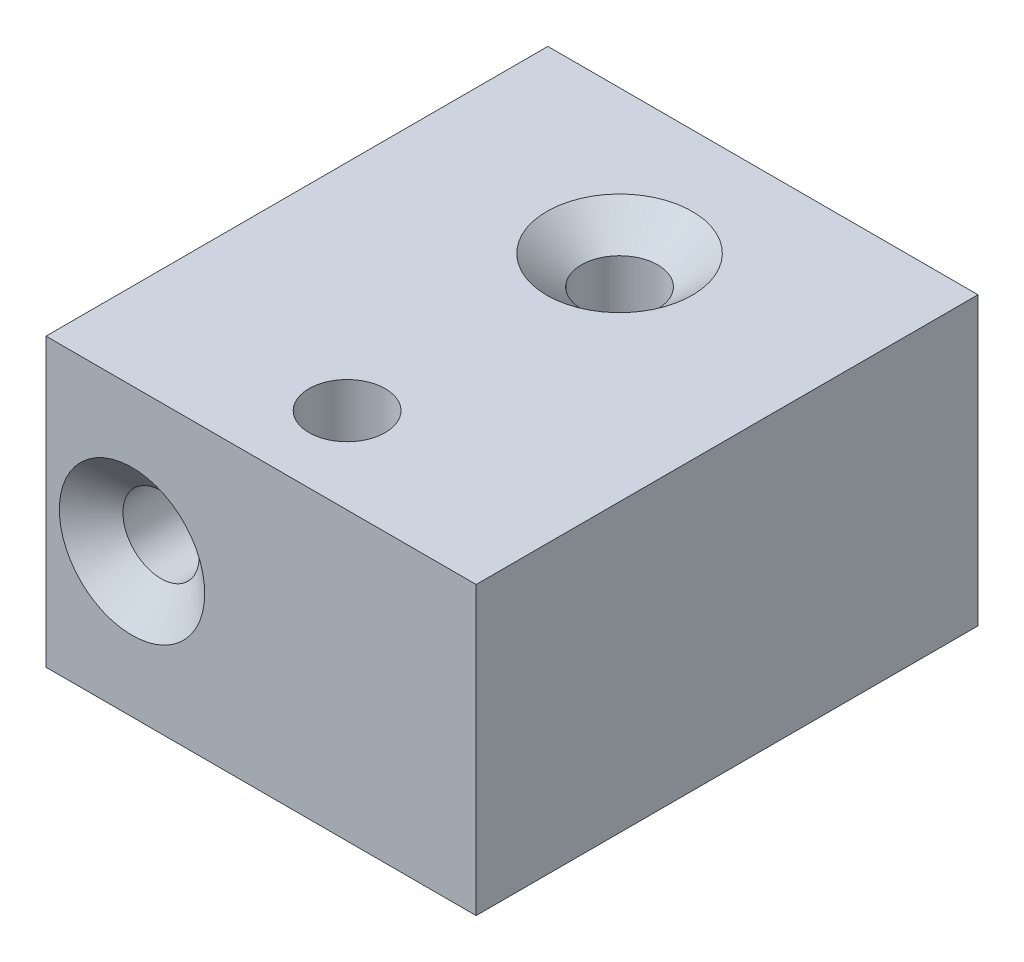
from build123d import *

# Parameters (mm, degrees)
SKETCH1_W                                           = 38.1
SKETCH1_H                                           = 44.45
BOSS_EXTRUDE1_DEPTH                                 = 25.4
CSK_FOR_1_4_FLAT_HEAD_MACHINE_SCREW_100_D           = 6.7564
CSK_FOR_1_4_FLAT_HEAD_MACHINE_SCREW_100_CSINK_D     = 12.8778
CSK_FOR_1_4_FLAT_HEAD_MACHINE_SCREW_100_CSINK_ANGLE = 100
CSK_FOR_1_4_FLAT_HEAD_MACHINE_SCREW_2_D             = 6.7564
CSK_FOR_1_4_FLAT_HEAD_MACHINE_SCREW_2_CSINK_D       = 12.8778
CSK_FOR_1_4_FLAT_HEAD_MACHINE_SCREW_2_CSINK_ANGLE   = 100


# Read off the part's stored shape, not the designer's step: CSK for 1/4 Flat Head Machine Screw (100)3
with BuildPart() as part:
    # Sketch1 → Boss-Extrude1 (new body)
    with BuildSketch(Plane(origin=(0, 0, 0), x_dir=(1, 0, 0), z_dir=(0, 1, 0))):
        Rectangle(SKETCH1_W, SKETCH1_H)
    extrude(amount=BOSS_EXTRUDE1_DEPTH)

    # CSK for 1_4 Flat Head Machine Screw _100 (through all)
    with Locations(Plane(origin=(0, 25.4, 0), x_dir=(1, 0, 0), z_dir=(0, 1, 0))):
        with Locations((0, 9.525)):
            CounterSinkHole(CSK_FOR_1_4_FLAT_HEAD_MACHINE_SCREW_100_D / 2, CSK_FOR_1_4_FLAT_HEAD_MACHINE_SCREW_100_CSINK_D / 2, counter_sink_angle=CSK_FOR_1_4_FLAT_HEAD_MACHINE_SCREW_100_CSINK_ANGLE)

    # CSK for 1_4 Flat Head Machine Screw  2 (through all)
    with Locations(Plane.XZ):
        with Locations((0, 14.605)):
            CounterSinkHole(CSK_FOR_1_4_FLAT_HEAD_MACHINE_SCREW_2_D / 2, CSK_FOR_1_4_FLAT_HEAD_MACHINE_SCREW_2_CSINK_D / 2, counter_sink_angle=CSK_FOR_1_4_FLAT_HEAD_MACHINE_SCREW_2_CSINK_ANGLE)

    # CSK for 1_4 Flat Head Machine Screw 3 ou → CSK for 1_4 Flat Head Machine Screw  3 (revolve, cut)
    with BuildSketch(Plane(origin=(-11.43, 12.7, 0), x_dir=(1, 0, 0), z_dir=(0, -1, 0))):
        Polygon((0, -22.225), (3.3782, -22.225), (3.3782, 19.656767759), (6.4389, 22.225), (0, 22.225), align=None)
    revolve(axis=Axis((-11.43, 12.7, 0), (0, 0, 1)), mode=Mode.SUBTRACT)


solid = part.part
